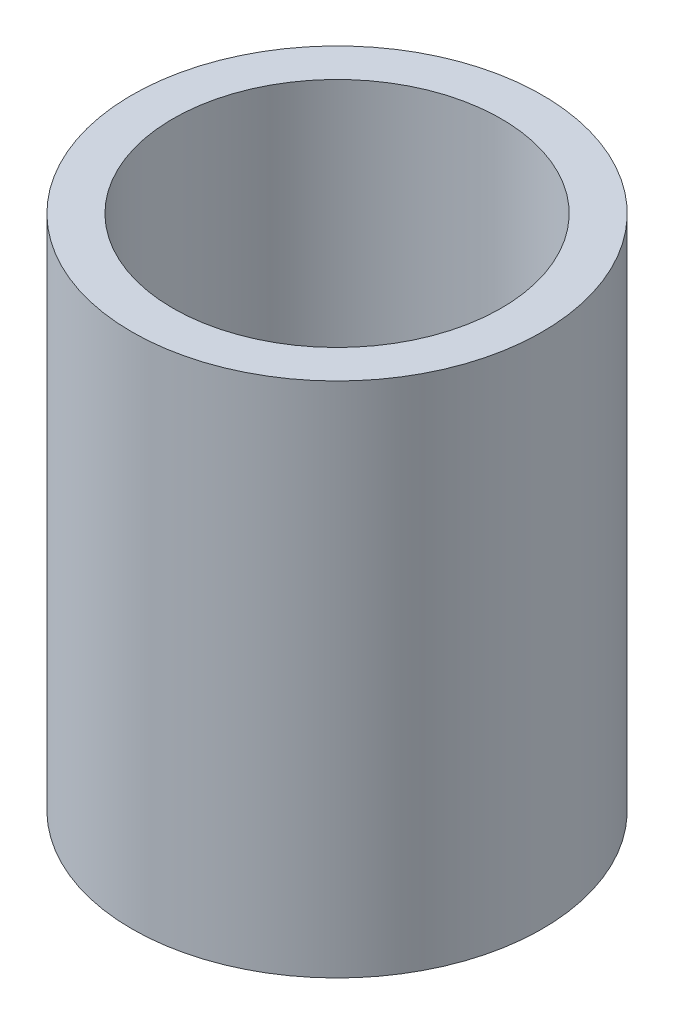
from build123d import *

# Parameters (mm, degrees)
SKETCH1_R           = 7.9375
SKETCH1_R_2         = 6.35
BOSS_EXTRUDE1_DEPTH = 20.0000108


with BuildPart() as part:
    # Sketch1 → Boss-Extrude1 (new body)
    with BuildSketch(Plane(origin=(0, 0, 0), x_dir=(1, 0, 0), z_dir=(0, 1, 0))):
        Circle(SKETCH1_R)
        Circle(SKETCH1_R_2, mode=Mode.SUBTRACT)
    extrude(amount=BOSS_EXTRUDE1_DEPTH)


solid = part.part
